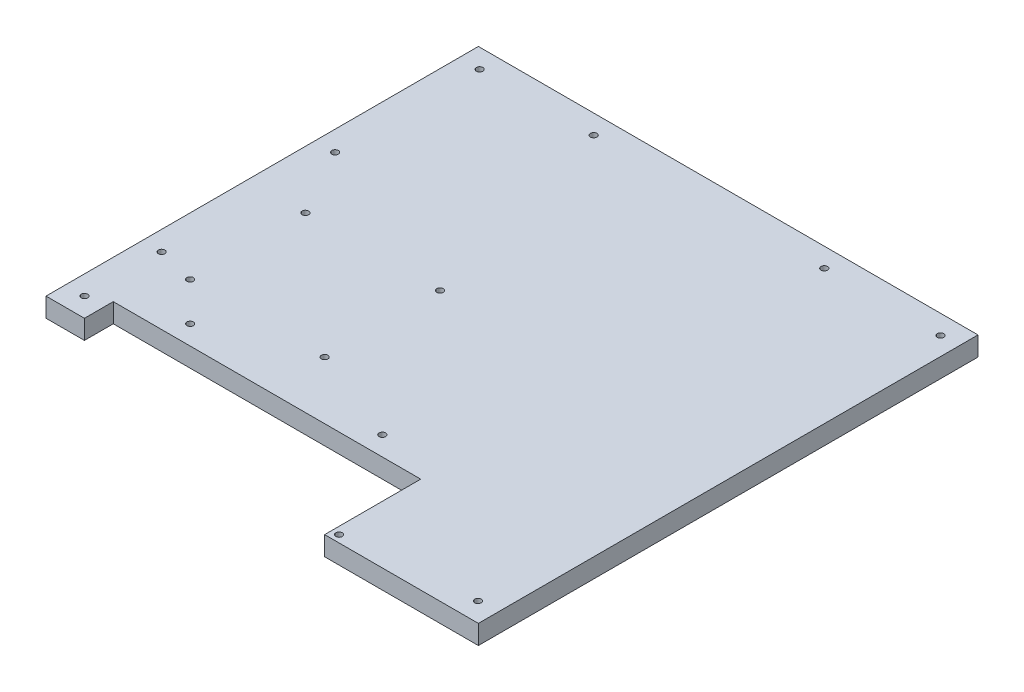
from build123d import *

# Parameters (mm, degrees)
BOSS_EXTRUDE1_DEPTH              = 12.7
F_6_CLEARANCE_HOLE1_D            = 4.3053
F_6_CLEARANCE_HOLE3_MOUNT_SIDE_D = 4.3053
F_6_CLEARANCE_HOLE2_D            = 4.3053


with BuildPart() as part:
    # Sketch1 → Boss-Extrude1 (new body)
    with BuildSketch(Plane(origin=(0, 0, 0), x_dir=(1, 0, 0), z_dir=(0, 1, 0))):
        Polygon((-165.1, -120.65), (-165.1, 165.1), (165.1, 165.1), (165.1, -165.1), (63.5, -165.1), (63.5, -101.6), (-139.7, -101.6), (-139.7, -120.65), align=None)
    extrude(amount=BOSS_EXTRUDE1_DEPTH)

    # #6 Clearance Hole1 (through all)
    with Locations(Plane(origin=(-76.2, 12.7, -152.4), x_dir=(0, 0, 1), z_dir=(0, 1, 0))):
        with Locations((0, 0), (0, 152.4), (0, -75.3745), (0, 229.2477), (304.8, 228.3079), (312.7375, 144.4625), (260.35, -76.2), (241.3, -25.4), (241.3, 101.6)):
            Hole(F_6_CLEARANCE_HOLE1_D / 2)

    # #6 Clearance Hole3 - Mount Side (through all)
    with Locations(Plane(origin=(-151.8539, 12.7, -57.149523043), x_dir=(0, 0, 1), z_dir=(0, 1, 0))):
        with Locations((0, 0), (114.299523043, -0.3302)):
            Hole(F_6_CLEARANCE_HOLE3_MOUNT_SIDE_D / 2)

    # #6 Clearance Hole2 (through all)
    with Locations(Plane(origin=(-127, 12.7, -12.7), x_dir=(0, 0, 1), z_dir=(0, 1, 0))):
        with Locations((0, 0), (0, 88.9), (76.2, 88.9), (76.2, 0)):
            Hole(F_6_CLEARANCE_HOLE2_D / 2)


solid = part.part
